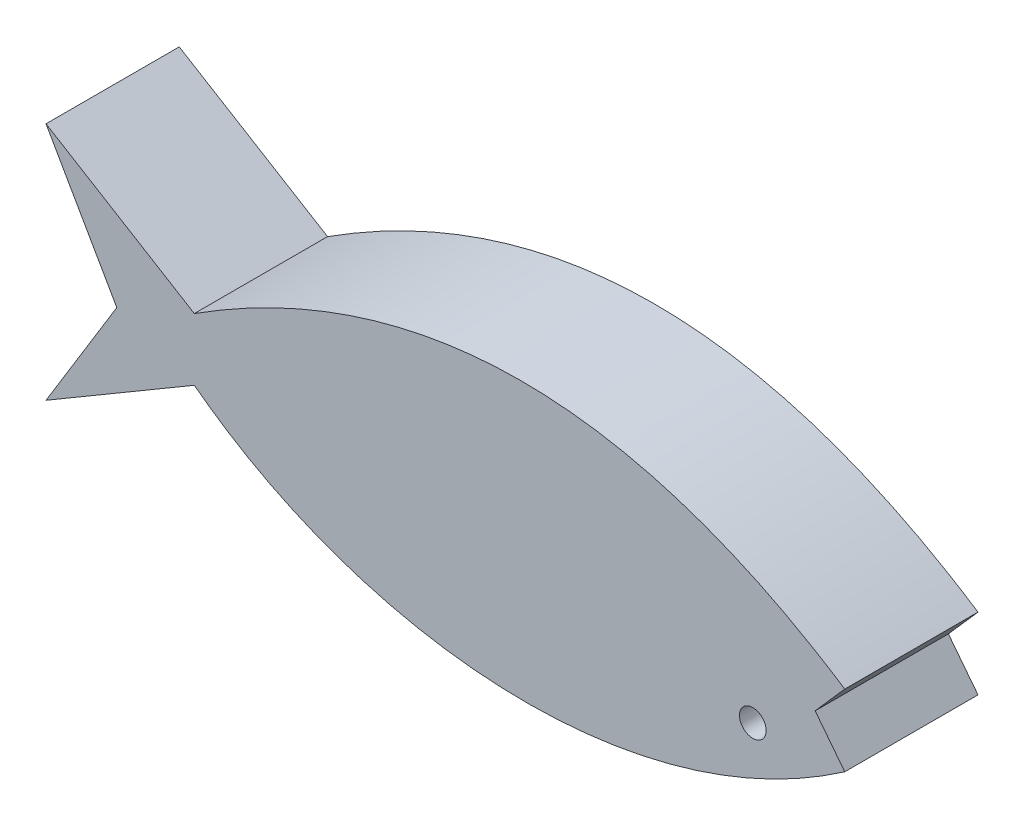
from build123d import *

# Parameters (mm, degrees)
SKETCH2_R           = 0.500109693
BOSS_EXTRUDE1_DEPTH = 5
BOSS_EXTRUDE2_DEPTH = 1


with BuildPart() as part:
    # Sketch2 → Boss-Extrude1 (new body)
    with BuildSketch(Plane(origin=(0, 0, 0), x_dir=(1, 0, 0), z_dir=(0, 0, -1))):
        with BuildLine():
            Line((29.97295835, 6.642737104), (28.862437793, 5.215722686))
            Line((28.862437793, 5.215722686), (29.97295835, 3.953817374))
            add(Edge.make_bspline(
                [(5.565346412, 3.953817374), (17.919076804, -3.939717318), (29.97295835, 3.953817374)],
                knots=[0, 0, 0, 1, 1, 1], degree=2))
            Line((5.565346412, 3.953817374), (0, 0.570103483))
            Line((0, 0.570103483), (2.65645961, 5.215722686))
            Line((2.65645961, 5.215722686), (0, 9.556126627))
            Line((0, 9.556126627), (5.565346412, 6.285726684))
            add(Edge.make_bspline(
                [(5.565346412, 6.285726684), (12.037313538, 11.217277608), (22.14175538, 12.07873787), (29.97295835, 6.642737104)],
                knots=[0, 0, 0, 0, 1, 1, 1, 1], degree=3))
        make_face()
        with Locations((26.5225963, 6.780666166)):
            Circle(SKETCH2_R, mode=Mode.SUBTRACT)
    extrude(amount=BOSS_EXTRUDE1_DEPTH)

    # Sketch4 → Boss-Extrude2 (add)
    with BuildSketch(Plane(origin=(0, 0, -5), x_dir=(1, 0, 0), z_dir=(0, 0, -1))):
        with BuildLine():
            Line((18.043081874, 7.717129188), (20.110614831, 7.717129188))
            add(Edge.make_bspline(
                [(20.110614831, 7.717129188), (20.570264017, 5.759735471), (22.550997792, 4.521006355)],
                knots=[0, 0, 0, 1, 1, 1], degree=2))
            Line((22.550997792, 4.521006355), (22.550997792, 2.477940023))
            Line((22.550997792, 2.477940023), (13.205641594, 2.477940023))
            Line((13.205641594, 2.477940023), (13.205641594, 5.036954171))
            Line((13.205641594, 5.036954171), (19.211449412, 5.036954171))
            add(Edge.make_bspline(
                [(19.211449412, 5.036954171), (18.753280039, 5.936387048), (18.155734078, 6.715920986), (18.043081874, 7.717129188)],
                knots=[0, 0, 0, 0, 1, 1, 1, 1], degree=3))
        make_face()
    extrude(amount=BOSS_EXTRUDE2_DEPTH)


solid = part.part
